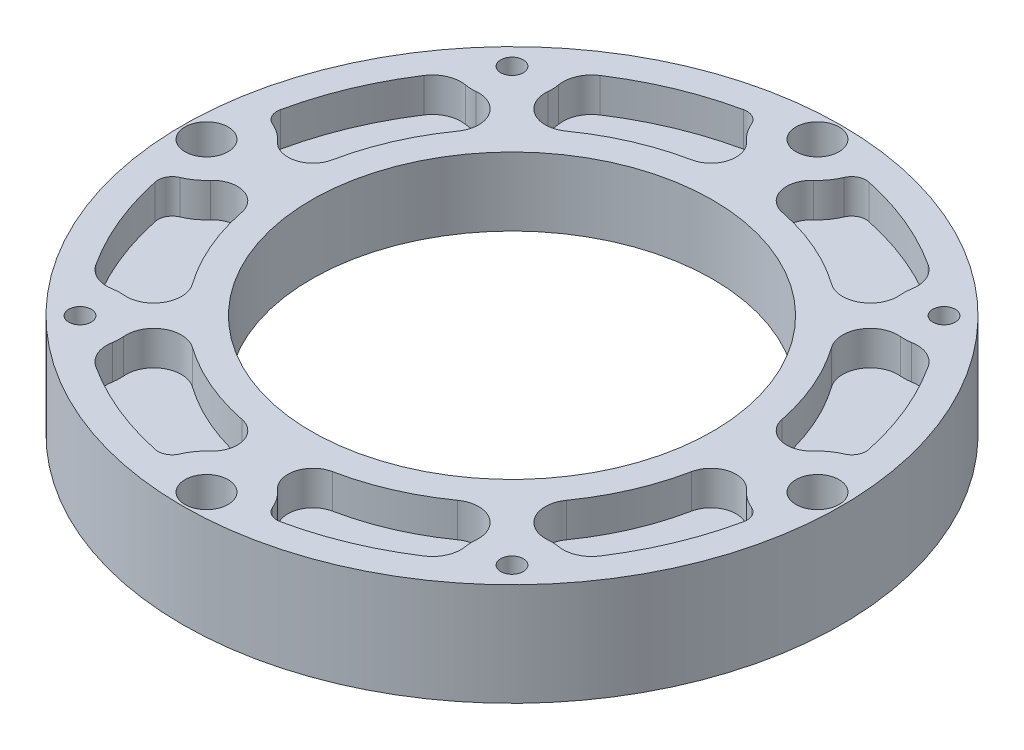
from build123d import *

# Parameters (mm, degrees)
SKETCH1_R           = 45.85
SKETCH1_R_2         = 1.5635
SKETCH1_R_3         = 40.5
BOSS_EXTRUDE1_DEPTH = 4.7625
BOSS_EXTRUDE2_START = 4.7625
SKETCH1_4_R         = 45.85
SKETCH1_4_R_2       = 1.5635
SKETCH1_4_R_3       = 27.9
BOSS_EXTRUDE2_DEPTH = 4.7625
CUT_EXTRUDE2_DEPTH  = 4.7625
BOSS_EXTRUDE3_START = 4.7625
SKETCH3_R           = 45.85
SKETCH3_R_2         = 3
SKETCH3_R_3         = 27.9
SKETCH3_R_4         = 1.565
BOSS_EXTRUDE3_DEPTH = 4.7625
CUT_EXTRUDE3_DEPTH  = 4.7625


with BuildPart() as part:
    # Sketch1 → Boss-Extrude1 (new body)
    with BuildSketch(Plane(origin=(0, 0, 0), x_dir=(1, 0, 0), z_dir=(0, 1, 0))):
        Circle(SKETCH1_R)
        with Locations((-30.0520382, -30.0520382)):
            Circle(SKETCH1_R_2, mode=Mode.SUBTRACT)
        with Locations((0, -42.5)):
            Circle(SKETCH1_R_2, mode=Mode.SUBTRACT)
        with Locations((30.0520382, -30.0520382)):
            Circle(SKETCH1_R_2, mode=Mode.SUBTRACT)
        with Locations((-42.5, 0)):
            Circle(SKETCH1_R_2, mode=Mode.SUBTRACT)
        with Locations((-30.0520382, 30.0520382)):
            Circle(SKETCH1_R_2, mode=Mode.SUBTRACT)
        Circle(SKETCH1_R_3, mode=Mode.SUBTRACT)
        with Locations((42.5, 0)):
            Circle(SKETCH1_R_2, mode=Mode.SUBTRACT)
        with Locations((0, 42.5)):
            Circle(SKETCH1_R_2, mode=Mode.SUBTRACT)
        with Locations((30.0520382, 30.0520382)):
            Circle(SKETCH1_R_2, mode=Mode.SUBTRACT)
    extrude(amount=-BOSS_EXTRUDE1_DEPTH)

    # Sketch1<4> → Boss-Extrude2 (add)
    with BuildSketch(Plane(origin=(0, 0, 0), x_dir=(1, 0, 0), z_dir=(0, 1, 0)).offset(BOSS_EXTRUDE2_START)):
        Circle(SKETCH1_4_R)
        with Locations((-30.0520382, -30.0520382)):
            Circle(SKETCH1_4_R_2, mode=Mode.SUBTRACT)
        with Locations((0, -42.5)):
            Circle(SKETCH1_4_R_2, mode=Mode.SUBTRACT)
        with Locations((30.0520382, -30.0520382)):
            Circle(SKETCH1_4_R_2, mode=Mode.SUBTRACT)
        with Locations((-42.5, 0)):
            Circle(SKETCH1_4_R_2, mode=Mode.SUBTRACT)
        with Locations((-30.0520382, 30.0520382)):
            Circle(SKETCH1_4_R_2, mode=Mode.SUBTRACT)
        with Locations((42.5, 0)):
            Circle(SKETCH1_4_R_2, mode=Mode.SUBTRACT)
        with Locations((0, 42.5)):
            Circle(SKETCH1_4_R_2, mode=Mode.SUBTRACT)
        with Locations((30.0520382, 30.0520382)):
            Circle(SKETCH1_4_R_2, mode=Mode.SUBTRACT)
        Circle(SKETCH1_4_R_3, mode=Mode.SUBTRACT)
    extrude(amount=-BOSS_EXTRUDE2_DEPTH)

    # Sketch4 → Cut-Extrude2 (cut)
    with BuildSketch(Plane(origin=(0, 4.7625, 0), x_dir=(1, 0, 0), z_dir=(0, 1, 0))):
        Polygon((28.493192474, -27.3520382), (26.934346747, -30.0520382), (28.493192474, -32.7520382), (31.610883927, -32.7520382), (33.169729654, -30.0520382), (31.610883927, -27.3520382), align=None)
        Polygon((30.0520382, 33.169729654), (27.3520382, 31.610883927), (27.3520382, 28.493192474), (30.0520382, 26.934346747), (32.7520382, 28.493192474), (32.7520382, 31.610883927), align=None)
        Polygon((-27.3520382, -28.493192474), (-30.0520382, -26.934346747), (-32.7520382, -28.493192474), (-32.7520382, -31.610883927), (-30.0520382, -33.169729654), (-27.3520382, -31.610883927), align=None)
        Polygon((-28.493192474, 27.3520382), (-26.934346747, 30.0520382), (-28.493192474, 32.7520382), (-31.610883927, 32.7520382), (-33.169729654, 30.0520382), (-31.610883927, 27.3520382), align=None)
    extrude(amount=-CUT_EXTRUDE2_DEPTH, mode=Mode.SUBTRACT)

    # Sketch3 → Boss-Extrude3 (add)
    with BuildSketch(Plane(origin=(0, 4.7625, 0), x_dir=(1, 0, 0), z_dir=(0, 1, 0)).offset(BOSS_EXTRUDE3_START)):
        Circle(SKETCH3_R)
        with Locations((0, -42.5)):
            Circle(SKETCH3_R_2, mode=Mode.SUBTRACT)
        with Locations((-42.5, 0)):
            Circle(SKETCH3_R_2, mode=Mode.SUBTRACT)
        Circle(SKETCH3_R_3, mode=Mode.SUBTRACT)
        with Locations((42.5, 0)):
            Circle(SKETCH3_R_2, mode=Mode.SUBTRACT)
        with Locations((0, 42.5)):
            Circle(SKETCH3_R_2, mode=Mode.SUBTRACT)
        with Locations((-30.0520382, -30.0520382)):
            Circle(SKETCH3_R_4, mode=Mode.SUBTRACT)
        with Locations((30.0520382, -30.0520382)):
            Circle(SKETCH3_R_4, mode=Mode.SUBTRACT)
        with Locations((-30.0520382, 30.0520382)):
            Circle(SKETCH3_R_4, mode=Mode.SUBTRACT)
        with Locations((30.0520382, 30.0520382)):
            Circle(SKETCH3_R_4, mode=Mode.SUBTRACT)
    extrude(amount=-BOSS_EXTRUDE3_DEPTH)

    # Sketch5 → Cut-Extrude3 (cut)
    with BuildSketch(Plane(origin=(0, 9.525, 0), x_dir=(1, 0, 0), z_dir=(0, 1, 0))):
        with BuildLine():
            ThreePointArc((4.671798308, 37.287102479), (3.634036371, 33.772898191), (6.309965425, 31.26970317))
            ThreePointArc((6.309965425, 31.26970317), (12.655473824, 29.282229804), (18.45109725, 26.022432827))
            ThreePointArc((18.45109725, 26.022432827), (22.605901862, 25.830111778), (24.511865027, 29.526960863))
            ThreePointArc((24.511865027, 29.526960863), (24.491699249, 30.279756772), (24.573354379, 31.028382699))
            ThreePointArc((24.573354379, 31.028382699), (24.305611228, 33.320605538), (22.816151805, 35.083410849))
            ThreePointArc((22.816151805, 35.083410849), (16.026822368, 38.659584385), (8.698660301, 40.935996494))
            ThreePointArc((8.698660301, 40.935996494), (7.359804384, 40.753879197), (6.442297334, 39.761970588))
            ThreePointArc((6.442297334, 39.761970588), (5.693155849, 38.427166039), (4.671798308, 37.287102479))
        make_face()
        with BuildLine():
            ThreePointArc((40.935996494, 8.698660301), (38.659584385, 16.026822368), (35.083410849, 22.816151805))
            ThreePointArc((35.083410849, 22.816151805), (33.320605538, 24.305611228), (31.028382699, 24.573354379))
            ThreePointArc((31.028382699, 24.573354379), (30.279756772, 24.491699249), (29.526960863, 24.511865027))
            ThreePointArc((29.526960863, 24.511865027), (25.830111778, 22.605901862), (26.022432827, 18.45109725))
            ThreePointArc((26.022432827, 18.45109725), (29.282229804, 12.655473824), (31.26970317, 6.309965425))
            ThreePointArc((31.26970317, 6.309965425), (33.772898191, 3.634036371), (37.287102479, 4.671798308))
            ThreePointArc((37.287102479, 4.671798308), (38.427166039, 5.693155849), (39.761970588, 6.442297334))
            ThreePointArc((39.761970588, 6.442297334), (40.753879197, 7.359804384), (40.935996494, 8.698660301))
        make_face()
        with BuildLine():
            ThreePointArc((39.761970588, -6.442297334), (38.427166039, -5.693155849), (37.287102479, -4.671798308))
            ThreePointArc((37.287102479, -4.671798308), (33.772898191, -3.634036371), (31.26970317, -6.309965425))
            ThreePointArc((31.26970317, -6.309965425), (29.282229804, -12.655473824), (26.022432827, -18.45109725))
            ThreePointArc((26.022432827, -18.45109725), (25.830111778, -22.605901862), (29.526960863, -24.511865027))
            ThreePointArc((29.526960863, -24.511865027), (30.279756772, -24.491699249), (31.028382699, -24.573354379))
            ThreePointArc((31.028382699, -24.573354379), (33.320605538, -24.305611228), (35.083410849, -22.816151805))
            ThreePointArc((35.083410849, -22.816151805), (38.659584385, -16.026822368), (40.935996494, -8.698660301))
            ThreePointArc((40.935996494, -8.698660301), (40.753879197, -7.359804384), (39.761970588, -6.442297334))
        make_face()
        with BuildLine():
            ThreePointArc((24.573354379, -31.028382699), (24.491699249, -30.279756772), (24.511865027, -29.526960863))
            ThreePointArc((24.511865027, -29.526960863), (22.605901862, -25.830111778), (18.45109725, -26.022432827))
            ThreePointArc((18.45109725, -26.022432827), (12.655473824, -29.282229804), (6.309965425, -31.26970317))
            ThreePointArc((6.309965425, -31.26970317), (3.634036371, -33.772898191), (4.671798308, -37.287102479))
            ThreePointArc((4.671798308, -37.287102479), (5.693155849, -38.427166039), (6.442297334, -39.761970588))
            ThreePointArc((6.442297334, -39.761970588), (7.359804384, -40.753879197), (8.698660301, -40.935996494))
            ThreePointArc((8.698660301, -40.935996494), (16.026822368, -38.659584385), (22.816151805, -35.083410849))
            ThreePointArc((22.816151805, -35.083410849), (24.305611228, -33.320605538), (24.573354379, -31.028382699))
        make_face()
        with BuildLine():
            ThreePointArc((-6.442297334, -39.761970588), (-5.693155849, -38.427166039), (-4.671798308, -37.287102479))
            ThreePointArc((-4.671798308, -37.287102479), (-3.634036371, -33.772898191), (-6.309965425, -31.26970317))
            ThreePointArc((-6.309965425, -31.26970317), (-12.655473824, -29.282229804), (-18.45109725, -26.022432827))
            ThreePointArc((-18.45109725, -26.022432827), (-22.605901862, -25.830111778), (-24.511865027, -29.526960863))
            ThreePointArc((-24.511865027, -29.526960863), (-24.491699249, -30.279756772), (-24.573354379, -31.028382699))
            ThreePointArc((-24.573354379, -31.028382699), (-24.305611228, -33.320605538), (-22.816151805, -35.083410849))
            ThreePointArc((-22.816151805, -35.083410849), (-16.026822368, -38.659584385), (-8.698660301, -40.935996494))
            ThreePointArc((-8.698660301, -40.935996494), (-7.359804384, -40.753879197), (-6.442297334, -39.761970588))
        make_face()
        with BuildLine():
            ThreePointArc((-31.028382699, -24.573354379), (-30.279756772, -24.491699249), (-29.526960863, -24.511865027))
            ThreePointArc((-29.526960863, -24.511865027), (-25.830111778, -22.605901862), (-26.022432827, -18.45109725))
            ThreePointArc((-26.022432827, -18.45109725), (-29.282229804, -12.655473824), (-31.26970317, -6.309965425))
            ThreePointArc((-31.26970317, -6.309965425), (-33.772898191, -3.634036371), (-37.287102479, -4.671798308))
            ThreePointArc((-37.287102479, -4.671798308), (-38.427166039, -5.693155849), (-39.761970588, -6.442297334))
            ThreePointArc((-39.761970588, -6.442297334), (-40.753879197, -7.359804384), (-40.935996494, -8.698660301))
            ThreePointArc((-40.935996494, -8.698660301), (-38.659584385, -16.026822368), (-35.083410849, -22.816151805))
            ThreePointArc((-35.083410849, -22.816151805), (-33.320605538, -24.305611228), (-31.028382699, -24.573354379))
        make_face()
        with BuildLine():
            ThreePointArc((-39.761970588, 6.442297334), (-38.427166039, 5.693155849), (-37.287102479, 4.671798308))
            ThreePointArc((-37.287102479, 4.671798308), (-33.772898191, 3.634036371), (-31.26970317, 6.309965425))
            ThreePointArc((-31.26970317, 6.309965425), (-29.282229804, 12.655473824), (-26.022432827, 18.45109725))
            ThreePointArc((-26.022432827, 18.45109725), (-25.830111778, 22.605901862), (-29.526960863, 24.511865027))
            ThreePointArc((-29.526960863, 24.511865027), (-30.279756772, 24.491699249), (-31.028382699, 24.573354379))
            ThreePointArc((-31.028382699, 24.573354379), (-33.320605538, 24.305611228), (-35.083410849, 22.816151805))
            ThreePointArc((-35.083410849, 22.816151805), (-38.659584385, 16.026822368), (-40.935996494, 8.698660301))
            ThreePointArc((-40.935996494, 8.698660301), (-40.753879197, 7.359804384), (-39.761970588, 6.442297334))
        make_face()
        with BuildLine():
            ThreePointArc((-24.573354379, 31.028382699), (-24.491699249, 30.279756772), (-24.511865027, 29.526960863))
            ThreePointArc((-24.511865027, 29.526960863), (-22.605901862, 25.830111778), (-18.45109725, 26.022432827))
            ThreePointArc((-18.45109725, 26.022432827), (-12.655473824, 29.282229804), (-6.309965425, 31.26970317))
            ThreePointArc((-6.309965425, 31.26970317), (-3.634036371, 33.772898191), (-4.671798308, 37.287102479))
            ThreePointArc((-4.671798308, 37.287102479), (-5.693155849, 38.427166039), (-6.442297334, 39.761970588))
            ThreePointArc((-6.442297334, 39.761970588), (-7.359804384, 40.753879197), (-8.698660301, 40.935996494))
            ThreePointArc((-8.698660301, 40.935996494), (-16.026822368, 38.659584385), (-22.816151805, 35.083410849))
            ThreePointArc((-22.816151805, 35.083410849), (-24.305611228, 33.320605538), (-24.573354379, 31.028382699))
        make_face()
    extrude(amount=-CUT_EXTRUDE3_DEPTH, mode=Mode.SUBTRACT)


solid = part.part
